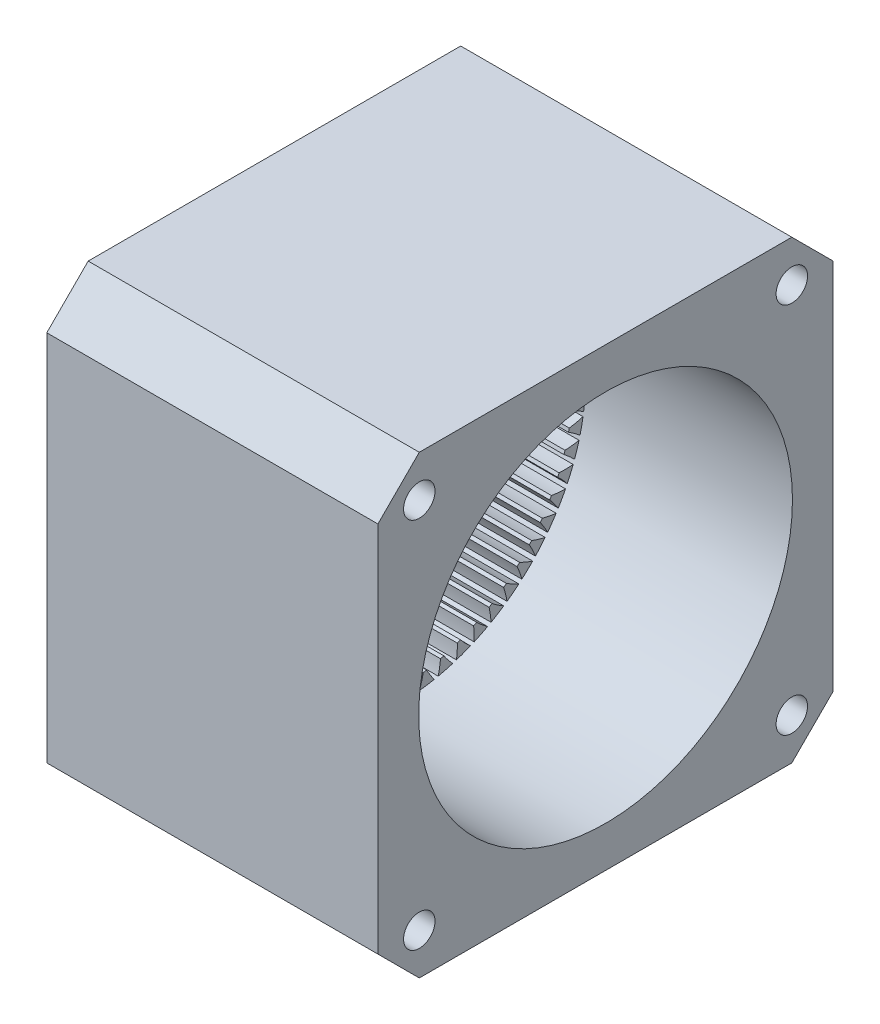
from build123d import *

# Parameters (mm, degrees)
BOSS_EXTRUDE1_START     = -15
BOSS_EXTRUDE1_OUTLINE_W = 55
BOSS_EXTRUDE1_OUTLINE_H = 55
BOSS_EXTRUDE1_DEPTH     = 15
SKETCH2_W               = 55
SKETCH2_H               = 55
SKETCH2_R               = 22.576
BOSS_EXTRUDE2_DEPTH     = 25
SKETCH3_R               = 1.9
CUT_EXTRUDE1_DEPTH      = 9
CHAMFER1_SIZE           = 5
CUT_EXTRUDE2_START      = -11
SKETCH4_R               = 1.9
CUT_EXTRUDE2_DEPTH      = 11


with BuildPart() as part:
    # Boss-Extrude1: read off the stored shape, not the designer's step
    # Boss-Extrude1 outline → Boss-Extrude1 (new body)
    with BuildSketch(Plane(origin=(15, 0, 0), x_dir=(0, 0, -1), z_dir=(1, 0, 0)).offset(BOSS_EXTRUDE1_START)):
        Rectangle(BOSS_EXTRUDE1_OUTLINE_W, BOSS_EXTRUDE1_OUTLINE_H)
        with BuildLine():
            ThreePointArc((0.241574021, 22.574707484), (0.579462287, 21.790723395), (0.854667122, 20.982600985))
            ThreePointArc((0.854667122, 20.982600985), (1.063632546, 20.973046651), (1.272492432, 20.961411284))
            ThreePointArc((1.272492432, 20.961411284), (1.628041668, 21.737545468), (2.043510693, 22.483323599))
            ThreePointArc((2.043510693, 22.483323599), (2.283976037, 22.460169845), (2.524179858, 22.434444322))
            ThreePointArc((2.524179858, 22.434444322), (2.781020174, 21.620299014), (2.973056634, 20.788480807))
            ThreePointArc((2.973056634, 20.788480807), (3.179983328, 20.757834811), (3.386594491, 20.725129137))
            ThreePointArc((3.386594491, 20.725129137), (3.818839711, 21.461310909), (4.307626222, 22.161230389))
            ThreePointArc((4.307626222, 22.161230389), (4.54451539, 22.113867954), (4.780884194, 22.063973403))
            ThreePointArc((4.780884194, 22.063973403), (4.954041031, 21.228021107), (5.060938561, 20.381042684))
            ThreePointArc((5.060938561, 20.381042684), (5.263703177, 20.329619496), (5.465945507, 20.27617912))
            ThreePointArc((5.465945507, 20.27617912), (5.970451292, 20.964854257), (6.527539676, 21.611732966))
            ThreePointArc((6.527539676, 21.611732966), (6.758421864, 21.540647852), (6.988530189, 21.467096259))
            ThreePointArc((6.988530189, 21.467096259), (7.076226723, 20.617914977), (7.096888411, 19.764467483))
            ThreePointArc((7.096888411, 19.764467483), (7.29341031, 19.692794775), (7.489208526, 19.619168067))
            ThreePointArc((7.489208526, 19.619168067), (8.060797963, 20.253269831), (8.680471741, 20.840469917))
            ThreePointArc((8.680471741, 20.840469917), (8.902977785, 20.746391555), (9.124464407, 20.649937658))
            ThreePointArc((9.124464407, 20.649937658), (9.125800753, 19.79624114), (9.060014582, 18.9450821))
            ThreePointArc((9.060014582, 18.9450821), (9.248277183, 18.853895331), (9.435622132, 18.760837801))
            ThreePointArc((9.435622132, 18.760837801), (10.068429939, 19.333859449), (10.744330418, 19.855355445))
            ThreePointArc((10.744330418, 19.855355445), (10.956177106, 19.739249206), (11.166769273, 19.620882753))
            ThreePointArc((11.166769273, 19.620882753), (11.081731719, 18.771431079), (10.930172743, 17.931294538))
            ThreePointArc((10.930172743, 17.931294538), (11.108244217, 17.821529407), (11.285213485, 17.709995951))
            ThreePointArc((11.285213485, 17.709995951), (11.972746199, 18.216057507), (12.697937726, 18.666498158))
            ThreePointArc((12.697937726, 18.666498158), (12.896951224, 18.529555449), (13.094487975, 18.390491039))
            ThreePointArc((13.094487975, 18.390491039), (12.923949121, 17.554000734), (12.688172541, 16.733507629))
            ThreePointArc((12.688172541, 16.733507629), (12.854225634, 16.606290476), (13.019003277, 16.477425578))
            ThreePointArc((13.019003277, 16.477425578), (13.754205882, 16.911334164), (14.52124701, 17.286097341))
            ThreePointArc((14.52124701, 17.286097341), (14.70538517, 17.129723378), (14.887839511, 16.971388001))
            ThreePointArc((14.887839511, 16.971388001), (14.633549316, 16.156442587), (14.315974518, 15.364012288))
            ThreePointArc((14.315974518, 15.364012288), (14.468305301, 15.220648532), (14.619200478, 15.07577452))
            ThreePointArc((14.619200478, 15.07577452), (15.3945288, 15.433077648), (16.19554865, 15.728317772))
            ThreePointArc((16.19554865, 15.728317772), (16.362921964, 15.554117165), (16.528421667, 15.378135557))
            ThreePointArc((16.528421667, 15.378135557), (16.192989492, 14.593097477), (15.796875225, 13.83686139))
            ThreePointArc((15.796875225, 13.83686139), (15.933920577, 13.678822137), (16.069384899, 13.519425615))
            ThreePointArc((16.069384899, 13.519425615), (16.876883019, 13.796456872), (17.703662044, 14.009144379))
            ThreePointArc((17.703662044, 14.009144379), (17.852553037, 13.818904662), (17.99939985, 13.627082631))
            ThreePointArc((17.99939985, 13.627082631), (17.586267684, 12.880007438), (17.115678615, 12.16772557))
            ThreePointArc((17.115678615, 12.16772557), (17.236032265, 11.996632517), (17.354675685, 11.824349109))
            ThreePointArc((17.354675685, 11.824349109), (18.186057581, 12.018265778), (19.030111908, 12.146218208))
            ThreePointArc((19.030111908, 12.146218208), (19.158992757, 11.941891497), (19.285679834, 11.736197397))
            ThreePointArc((19.285679834, 11.736197397), (18.799086972, 11.034751093), (18.258851982, 10.37373242))
            ThreePointArc((18.258851982, 10.37373242), (18.361278939, 10.191341213), (18.461884015, 10.00793878))
            ThreePointArc((18.461884015, 10.00793878), (19.308618583, 10.116751013), (20.161287073, 10.158655401))
            ThreePointArc((20.161287073, 10.158655401), (20.268835285, 9.942338365), (20.374062645, 9.724882897))
            ThreePointArc((20.374062645, 9.724882897), (19.819002188, 9.076263271), (19.214664819, 8.473290737))
            ThreePointArc((19.214664819, 8.473290737), (19.298114044, 8.281472957), (19.379648431, 8.088833456))
            ThreePointArc((19.379648431, 8.088833456), (20.233047029, 8.111424694), (21.08558015, 8.066851044))
            ThreePointArc((21.08558015, 8.066851044), (21.170692135, 7.840763388), (21.253380002, 7.613777938))
            ThreePointArc((21.253380002, 7.613777938), (20.635547621, 7.024640704), (19.973309193, 6.485901625))
            ThreePointArc((19.973309193, 6.485901625), (20.036924384, 6.286625582), (20.09855143, 6.086725755))
            ThreePointArc((20.09855143, 6.086725755), (20.949857033, 6.02286418), (21.79350664, 5.892269878))
            ThreePointArc((21.79350664, 5.892269878), (21.855309036, 5.658731569), (21.91460892, 5.424545314))
            ThreePointArc((21.91460892, 5.424545314), (21.240344412, 4.900935818), (20.527000386, 4.431958386))
            ThreePointArc((20.527000386, 4.431958386), (20.570128766, 4.227268922), (20.611216093, 4.022160011))
            ThreePointArc((20.611216093, 4.022160011), (21.451693155, 3.87250093), (22.277802262, 3.657226049))
            ThreePointArc((22.277802262, 3.657226049), (22.31566089, 3.418633505), (22.350964296, 3.179649515))
            ThreePointArc((22.350964296, 3.179649515), (21.627186527, 2.726940698), (20.870056779, 2.332537256))
            ThreePointArc((20.870056779, 2.332537256), (20.892255791, 2.124534762), (20.912381788, 1.916321462))
            ThreePointArc((20.912381788, 1.916321462), (21.733405876, 1.68240058), (22.533497486, 1.384654133))
            ThreePointArc((22.533497486, 1.384654133), (22.547023866, 1.143455636), (22.557968532, 0.902126209))
            ThreePointArc((22.557968532, 0.902126209), (21.792104442, 0.524963477), (20.998958147, 0.209181138))
            ThreePointArc((20.998958147, 0.209181138), (21, 0), (20.998958147, -0.209181138))
            ThreePointArc((20.998958147, -0.209181138), (21.792104442, -0.524963477), (22.557968532, -0.902126209))
            ThreePointArc((22.557968532, -0.902126209), (22.547023866, -1.143455636), (22.533497486, -1.384654133))
            ThreePointArc((22.533497486, -1.384654133), (21.733405876, -1.68240058), (20.912381788, -1.916321462))
            ThreePointArc((20.912381788, -1.916321462), (20.892255791, -2.124534762), (20.870056779, -2.332537256))
            ThreePointArc((20.870056779, -2.332537256), (21.627186527, -2.726940698), (22.350964296, -3.179649515))
            ThreePointArc((22.350964296, -3.179649515), (22.31566089, -3.418633505), (22.277802262, -3.657226049))
            ThreePointArc((22.277802262, -3.657226049), (21.451693155, -3.87250093), (20.611216093, -4.022160011))
            ThreePointArc((20.611216093, -4.022160011), (20.570128766, -4.227268922), (20.527000386, -4.431958386))
            ThreePointArc((20.527000386, -4.431958386), (21.240344412, -4.900935818), (21.91460892, -5.424545314))
            ThreePointArc((21.91460892, -5.424545314), (21.855309036, -5.658731569), (21.79350664, -5.892269878))
            ThreePointArc((21.79350664, -5.892269878), (20.949857033, -6.02286418), (20.09855143, -6.086725755))
            ThreePointArc((20.09855143, -6.086725755), (20.036924384, -6.286625582), (19.973309193, -6.485901625))
            ThreePointArc((19.973309193, -6.485901625), (20.635547621, -7.024640704), (21.253380002, -7.613777938))
            ThreePointArc((21.253380002, -7.613777938), (21.170692135, -7.840763388), (21.08558015, -8.066851044))
            ThreePointArc((21.08558015, -8.066851044), (20.233047029, -8.111424694), (19.379648431, -8.088833456))
            ThreePointArc((19.379648431, -8.088833456), (19.298114044, -8.281472957), (19.214664819, -8.473290737))
            ThreePointArc((19.214664819, -8.473290737), (19.819002188, -9.076263271), (20.374062645, -9.724882897))
            ThreePointArc((20.374062645, -9.724882897), (20.268835285, -9.942338365), (20.161287073, -10.158655401))
            ThreePointArc((20.161287073, -10.158655401), (19.308618583, -10.116751013), (18.461884015, -10.00793878))
            ThreePointArc((18.461884015, -10.00793878), (18.361278939, -10.191341213), (18.258851982, -10.37373242))
            ThreePointArc((18.258851982, -10.37373242), (18.799086972, -11.034751093), (19.285679834, -11.736197397))
            ThreePointArc((19.285679834, -11.736197397), (19.158992757, -11.941891497), (19.030111908, -12.146218208))
            ThreePointArc((19.030111908, -12.146218208), (18.186057581, -12.018265778), (17.354675685, -11.824349109))
            ThreePointArc((17.354675685, -11.824349109), (17.236032265, -11.996632517), (17.115678615, -12.16772557))
            ThreePointArc((17.115678615, -12.16772557), (17.586267684, -12.880007438), (17.99939985, -13.627082631))
            ThreePointArc((17.99939985, -13.627082631), (17.852553037, -13.818904662), (17.703662044, -14.009144379))
            ThreePointArc((17.703662044, -14.009144379), (16.876883019, -13.796456872), (16.069384899, -13.519425615))
            ThreePointArc((16.069384899, -13.519425615), (15.933920577, -13.678822137), (15.796875225, -13.83686139))
            ThreePointArc((15.796875225, -13.83686139), (16.192989492, -14.593097477), (16.528421667, -15.378135557))
            ThreePointArc((16.528421667, -15.378135557), (16.362921964, -15.554117165), (16.19554865, -15.728317772))
            ThreePointArc((16.19554865, -15.728317772), (15.3945288, -15.433077648), (14.619200478, -15.07577452))
            ThreePointArc((14.619200478, -15.07577452), (14.468305301, -15.220648532), (14.315974518, -15.364012288))
            ThreePointArc((14.315974518, -15.364012288), (14.633549316, -16.156442587), (14.887839511, -16.971388001))
            ThreePointArc((14.887839511, -16.971388001), (14.70538517, -17.129723378), (14.52124701, -17.286097341))
            ThreePointArc((14.52124701, -17.286097341), (13.754205882, -16.911334164), (13.019003277, -16.477425578))
            ThreePointArc((13.019003277, -16.477425578), (12.854225634, -16.606290476), (12.688172541, -16.733507629))
            ThreePointArc((12.688172541, -16.733507629), (12.923949121, -17.554000734), (13.094487975, -18.390491039))
            ThreePointArc((13.094487975, -18.390491039), (12.896951224, -18.529555449), (12.697937726, -18.666498158))
            ThreePointArc((12.697937726, -18.666498158), (11.972746199, -18.216057507), (11.285213485, -17.709995951))
            ThreePointArc((11.285213485, -17.709995951), (11.108244217, -17.821529407), (10.930172743, -17.931294538))
            ThreePointArc((10.930172743, -17.931294538), (11.081731719, -18.771431079), (11.166769273, -19.620882753))
            ThreePointArc((11.166769273, -19.620882753), (10.956177106, -19.739249206), (10.744330418, -19.855355445))
            ThreePointArc((10.744330418, -19.855355445), (10.068429939, -19.333859449), (9.435622132, -18.760837801))
            ThreePointArc((9.435622132, -18.760837801), (9.248277183, -18.853895331), (9.060014582, -18.9450821))
            ThreePointArc((9.060014582, -18.9450821), (9.125800753, -19.79624114), (9.124464407, -20.649937658))
            ThreePointArc((9.124464407, -20.649937658), (8.902977785, -20.746391555), (8.680471741, -20.840469917))
            ThreePointArc((8.680471741, -20.840469917), (8.060797963, -20.253269831), (7.489208526, -19.619168067))
            ThreePointArc((7.489208526, -19.619168067), (7.29341031, -19.692794775), (7.096888411, -19.764467483))
            ThreePointArc((7.096888411, -19.764467483), (7.076226723, -20.617914977), (6.988530189, -21.467096259))
            ThreePointArc((6.988530189, -21.467096259), (6.758421864, -21.540647852), (6.527539676, -21.611732966))
            ThreePointArc((6.527539676, -21.611732966), (5.970451292, -20.964854257), (5.465945507, -20.27617912))
            ThreePointArc((5.465945507, -20.27617912), (5.263703177, -20.329619496), (5.060938561, -20.381042684))
            ThreePointArc((5.060938561, -20.381042684), (4.954041031, -21.228021107), (4.780884194, -22.063973403))
            ThreePointArc((4.780884194, -22.063973403), (4.54451539, -22.113867954), (4.307626222, -22.161230389))
            ThreePointArc((4.307626222, -22.161230389), (3.818839711, -21.461310909), (3.386594491, -20.725129137))
            ThreePointArc((3.386594491, -20.725129137), (3.179983328, -20.757834811), (2.973056634, -20.788480807))
            ThreePointArc((2.973056634, -20.788480807), (2.781020174, -21.620299014), (2.524179858, -22.434444322))
            ThreePointArc((2.524179858, -22.434444322), (2.283976037, -22.460169845), (2.043510693, -22.483323599))
            ThreePointArc((2.043510693, -22.483323599), (1.628041668, -21.737545468), (1.272492432, -20.961411284))
            ThreePointArc((1.272492432, -20.961411284), (1.063632546, -20.973046651), (0.854667122, -20.982600985))
            ThreePointArc((0.854667122, -20.982600985), (0.579462287, -21.790723395), (0.241574021, -22.574707484))
            ThreePointArc((0.241574021, -22.574707484), (0, -22.576), (-0.241574021, -22.574707484))
            ThreePointArc((-0.241574021, -22.574707484), (-0.579462287, -21.790723395), (-0.854667122, -20.982600985))
            ThreePointArc((-0.854667122, -20.982600985), (-1.063632546, -20.973046651), (-1.272492432, -20.961411284))
            ThreePointArc((-1.272492432, -20.961411284), (-1.628041668, -21.737545468), (-2.043510693, -22.483323599))
            ThreePointArc((-2.043510693, -22.483323599), (-2.283976037, -22.460169845), (-2.524179858, -22.434444322))
            ThreePointArc((-2.524179858, -22.434444322), (-2.781020174, -21.620299014), (-2.973056634, -20.788480807))
            ThreePointArc((-2.973056634, -20.788480807), (-3.179983328, -20.757834811), (-3.386594491, -20.725129137))
            ThreePointArc((-3.386594491, -20.725129137), (-3.818839711, -21.461310909), (-4.307626222, -22.161230389))
            ThreePointArc((-4.307626222, -22.161230389), (-4.54451539, -22.113867954), (-4.780884194, -22.063973403))
            ThreePointArc((-4.780884194, -22.063973403), (-4.954041031, -21.228021107), (-5.060938561, -20.381042684))
            ThreePointArc((-5.060938561, -20.381042684), (-5.263703177, -20.329619496), (-5.465945507, -20.27617912))
            ThreePointArc((-5.465945507, -20.27617912), (-5.970451292, -20.964854257), (-6.527539676, -21.611732966))
            ThreePointArc((-6.527539676, -21.611732966), (-6.758421864, -21.540647852), (-6.988530189, -21.467096259))
            ThreePointArc((-6.988530189, -21.467096259), (-7.076226723, -20.617914977), (-7.096888411, -19.764467483))
            ThreePointArc((-7.096888411, -19.764467483), (-7.29341031, -19.692794775), (-7.489208526, -19.619168067))
            ThreePointArc((-7.489208526, -19.619168067), (-8.060797963, -20.253269831), (-8.680471741, -20.840469917))
            ThreePointArc((-8.680471741, -20.840469917), (-8.902977785, -20.746391555), (-9.124464407, -20.649937658))
            ThreePointArc((-9.124464407, -20.649937658), (-9.125800753, -19.79624114), (-9.060014582, -18.9450821))
            ThreePointArc((-9.060014582, -18.9450821), (-9.248277183, -18.853895331), (-9.435622132, -18.760837801))
            ThreePointArc((-9.435622132, -18.760837801), (-10.068429939, -19.333859449), (-10.744330418, -19.855355445))
            ThreePointArc((-10.744330418, -19.855355445), (-10.956177106, -19.739249206), (-11.166769273, -19.620882753))
            ThreePointArc((-11.166769273, -19.620882753), (-11.081731719, -18.771431079), (-10.930172743, -17.931294538))
            ThreePointArc((-10.930172743, -17.931294538), (-11.108244217, -17.821529407), (-11.285213485, -17.709995951))
            ThreePointArc((-11.285213485, -17.709995951), (-11.972746199, -18.216057507), (-12.697937726, -18.666498158))
            ThreePointArc((-12.697937726, -18.666498158), (-12.896951224, -18.529555449), (-13.094487975, -18.390491039))
            ThreePointArc((-13.094487975, -18.390491039), (-12.923949121, -17.554000734), (-12.688172541, -16.733507629))
            ThreePointArc((-12.688172541, -16.733507629), (-12.854225634, -16.606290476), (-13.019003277, -16.477425578))
            ThreePointArc((-13.019003277, -16.477425578), (-13.754205882, -16.911334164), (-14.52124701, -17.286097341))
            ThreePointArc((-14.52124701, -17.286097341), (-14.70538517, -17.129723378), (-14.887839511, -16.971388001))
            ThreePointArc((-14.887839511, -16.971388001), (-14.633549316, -16.156442587), (-14.315974518, -15.364012288))
            ThreePointArc((-14.315974518, -15.364012288), (-14.468305301, -15.220648532), (-14.619200478, -15.07577452))
            ThreePointArc((-14.619200478, -15.07577452), (-15.3945288, -15.433077648), (-16.19554865, -15.728317772))
            ThreePointArc((-16.19554865, -15.728317772), (-16.362921964, -15.554117165), (-16.528421667, -15.378135557))
            ThreePointArc((-16.528421667, -15.378135557), (-16.192989492, -14.593097477), (-15.796875225, -13.83686139))
            ThreePointArc((-15.796875225, -13.83686139), (-15.933920577, -13.678822137), (-16.069384899, -13.519425615))
            ThreePointArc((-16.069384899, -13.519425615), (-16.876883019, -13.796456872), (-17.703662044, -14.009144379))
            ThreePointArc((-17.703662044, -14.009144379), (-17.852553037, -13.818904662), (-17.99939985, -13.627082631))
            ThreePointArc((-17.99939985, -13.627082631), (-17.586267684, -12.880007438), (-17.115678615, -12.16772557))
            ThreePointArc((-17.115678615, -12.16772557), (-17.236032265, -11.996632517), (-17.354675685, -11.824349109))
            ThreePointArc((-17.354675685, -11.824349109), (-18.186057581, -12.018265778), (-19.030111908, -12.146218208))
            ThreePointArc((-19.030111908, -12.146218208), (-19.158992757, -11.941891497), (-19.285679834, -11.736197397))
            ThreePointArc((-19.285679834, -11.736197397), (-18.799086972, -11.034751093), (-18.258851982, -10.37373242))
            ThreePointArc((-18.258851982, -10.37373242), (-18.361278939, -10.191341213), (-18.461884015, -10.00793878))
            ThreePointArc((-18.461884015, -10.00793878), (-19.308618583, -10.116751013), (-20.161287073, -10.158655401))
            ThreePointArc((-20.161287073, -10.158655401), (-20.268835285, -9.942338365), (-20.374062645, -9.724882897))
            ThreePointArc((-20.374062645, -9.724882897), (-19.819002188, -9.076263271), (-19.214664819, -8.473290737))
            ThreePointArc((-19.214664819, -8.473290737), (-19.298114044, -8.281472957), (-19.379648431, -8.088833456))
            ThreePointArc((-19.379648431, -8.088833456), (-20.233047029, -8.111424694), (-21.08558015, -8.066851044))
            ThreePointArc((-21.08558015, -8.066851044), (-21.170692135, -7.840763388), (-21.253380002, -7.613777938))
            ThreePointArc((-21.253380002, -7.613777938), (-20.635547621, -7.024640704), (-19.973309193, -6.485901625))
            ThreePointArc((-19.973309193, -6.485901625), (-20.036924384, -6.286625582), (-20.09855143, -6.086725755))
            ThreePointArc((-20.09855143, -6.086725755), (-20.949857033, -6.02286418), (-21.79350664, -5.892269878))
            ThreePointArc((-21.79350664, -5.892269878), (-21.855309036, -5.658731569), (-21.91460892, -5.424545314))
            ThreePointArc((-21.91460892, -5.424545314), (-21.240344412, -4.900935818), (-20.527000386, -4.431958386))
            ThreePointArc((-20.527000386, -4.431958386), (-20.570128766, -4.227268922), (-20.611216093, -4.022160011))
            ThreePointArc((-20.611216093, -4.022160011), (-21.451693155, -3.87250093), (-22.277802262, -3.657226049))
            ThreePointArc((-22.277802262, -3.657226049), (-22.31566089, -3.418633505), (-22.350964296, -3.179649515))
            ThreePointArc((-22.350964296, -3.179649515), (-21.627186527, -2.726940698), (-20.870056779, -2.332537256))
            ThreePointArc((-20.870056779, -2.332537256), (-20.892255791, -2.124534762), (-20.912381788, -1.916321462))
            ThreePointArc((-20.912381788, -1.916321462), (-21.733405876, -1.68240058), (-22.533497486, -1.384654133))
            ThreePointArc((-22.533497486, -1.384654133), (-22.547023866, -1.143455636), (-22.557968532, -0.902126209))
            ThreePointArc((-22.557968532, -0.902126209), (-21.792104442, -0.524963477), (-20.998958147, -0.209181138))
            ThreePointArc((-20.998958147, -0.209181138), (-21, 0), (-20.998958147, 0.209181138))
            ThreePointArc((-20.998958147, 0.209181138), (-21.792104442, 0.524963477), (-22.557968532, 0.902126209))
            ThreePointArc((-22.557968532, 0.902126209), (-22.547023866, 1.143455636), (-22.533497486, 1.384654133))
            ThreePointArc((-22.533497486, 1.384654133), (-21.733405876, 1.68240058), (-20.912381788, 1.916321462))
            ThreePointArc((-20.912381788, 1.916321462), (-20.892255791, 2.124534762), (-20.870056779, 2.332537256))
            ThreePointArc((-20.870056779, 2.332537256), (-21.627186527, 2.726940698), (-22.350964296, 3.179649515))
            ThreePointArc((-22.350964296, 3.179649515), (-22.31566089, 3.418633505), (-22.277802262, 3.657226049))
            ThreePointArc((-22.277802262, 3.657226049), (-21.451693155, 3.87250093), (-20.611216093, 4.022160011))
            ThreePointArc((-20.611216093, 4.022160011), (-20.570128766, 4.227268922), (-20.527000386, 4.431958386))
            ThreePointArc((-20.527000386, 4.431958386), (-21.240344412, 4.900935818), (-21.91460892, 5.424545314))
            ThreePointArc((-21.91460892, 5.424545314), (-21.855309036, 5.658731569), (-21.79350664, 5.892269878))
            ThreePointArc((-21.79350664, 5.892269878), (-20.949857033, 6.02286418), (-20.09855143, 6.086725755))
            ThreePointArc((-20.09855143, 6.086725755), (-20.036924384, 6.286625582), (-19.973309193, 6.485901625))
            ThreePointArc((-19.973309193, 6.485901625), (-20.635547621, 7.024640704), (-21.253380002, 7.613777938))
            ThreePointArc((-21.253380002, 7.613777938), (-21.170692135, 7.840763388), (-21.08558015, 8.066851044))
            ThreePointArc((-21.08558015, 8.066851044), (-20.233047029, 8.111424694), (-19.379648431, 8.088833456))
            ThreePointArc((-19.379648431, 8.088833456), (-19.298114044, 8.281472957), (-19.214664819, 8.473290737))
            ThreePointArc((-19.214664819, 8.473290737), (-19.819002188, 9.076263271), (-20.374062645, 9.724882897))
            ThreePointArc((-20.374062645, 9.724882897), (-20.268835285, 9.942338365), (-20.161287073, 10.158655401))
            ThreePointArc((-20.161287073, 10.158655401), (-19.308618583, 10.116751013), (-18.461884015, 10.00793878))
            ThreePointArc((-18.461884015, 10.00793878), (-18.361278939, 10.191341213), (-18.258851982, 10.37373242))
            ThreePointArc((-18.258851982, 10.37373242), (-18.799086972, 11.034751093), (-19.285679834, 11.736197397))
            ThreePointArc((-19.285679834, 11.736197397), (-19.158992757, 11.941891497), (-19.030111908, 12.146218208))
            ThreePointArc((-19.030111908, 12.146218208), (-18.186057581, 12.018265778), (-17.354675685, 11.824349109))
            ThreePointArc((-17.354675685, 11.824349109), (-17.236032265, 11.996632517), (-17.115678615, 12.16772557))
            ThreePointArc((-17.115678615, 12.16772557), (-17.586267684, 12.880007438), (-17.99939985, 13.627082631))
            ThreePointArc((-17.99939985, 13.627082631), (-17.852553037, 13.818904662), (-17.703662044, 14.009144379))
            ThreePointArc((-17.703662044, 14.009144379), (-16.876883019, 13.796456872), (-16.069384899, 13.519425615))
            ThreePointArc((-16.069384899, 13.519425615), (-15.933920577, 13.678822137), (-15.796875225, 13.83686139))
            ThreePointArc((-15.796875225, 13.83686139), (-16.192989492, 14.593097477), (-16.528421667, 15.378135557))
            ThreePointArc((-16.528421667, 15.378135557), (-16.362921964, 15.554117165), (-16.19554865, 15.728317772))
            ThreePointArc((-16.19554865, 15.728317772), (-15.3945288, 15.433077648), (-14.619200478, 15.07577452))
            ThreePointArc((-14.619200478, 15.07577452), (-14.468305301, 15.220648532), (-14.315974518, 15.364012288))
            ThreePointArc((-14.315974518, 15.364012288), (-14.633549316, 16.156442587), (-14.887839511, 16.971388001))
            ThreePointArc((-14.887839511, 16.971388001), (-14.70538517, 17.129723378), (-14.52124701, 17.286097341))
            ThreePointArc((-14.52124701, 17.286097341), (-13.754205882, 16.911334164), (-13.019003277, 16.477425578))
            ThreePointArc((-13.019003277, 16.477425578), (-12.854225634, 16.606290476), (-12.688172541, 16.733507629))
            ThreePointArc((-12.688172541, 16.733507629), (-12.923949121, 17.554000734), (-13.094487975, 18.390491039))
            ThreePointArc((-13.094487975, 18.390491039), (-12.896951224, 18.529555449), (-12.697937726, 18.666498158))
            ThreePointArc((-12.697937726, 18.666498158), (-11.972746199, 18.216057507), (-11.285213485, 17.709995951))
            ThreePointArc((-11.285213485, 17.709995951), (-11.108244217, 17.821529407), (-10.930172743, 17.931294538))
            ThreePointArc((-10.930172743, 17.931294538), (-11.081731719, 18.771431079), (-11.166769273, 19.620882753))
            ThreePointArc((-11.166769273, 19.620882753), (-10.956177106, 19.739249206), (-10.744330418, 19.855355445))
            ThreePointArc((-10.744330418, 19.855355445), (-10.068429939, 19.333859449), (-9.435622132, 18.760837801))
            ThreePointArc((-9.435622132, 18.760837801), (-9.248277183, 18.853895331), (-9.060014582, 18.9450821))
            ThreePointArc((-9.060014582, 18.9450821), (-9.125800753, 19.79624114), (-9.124464407, 20.649937658))
            ThreePointArc((-9.124464407, 20.649937658), (-8.902977785, 20.746391555), (-8.680471741, 20.840469917))
            ThreePointArc((-8.680471741, 20.840469917), (-8.060797963, 20.253269831), (-7.489208526, 19.619168067))
            ThreePointArc((-7.489208526, 19.619168067), (-7.29341031, 19.692794775), (-7.096888411, 19.764467483))
            ThreePointArc((-7.096888411, 19.764467483), (-7.076226723, 20.617914977), (-6.988530189, 21.467096259))
            ThreePointArc((-6.988530189, 21.467096259), (-6.758421864, 21.540647852), (-6.527539676, 21.611732966))
            ThreePointArc((-6.527539676, 21.611732966), (-5.970451292, 20.964854257), (-5.465945507, 20.27617912))
            ThreePointArc((-5.465945507, 20.27617912), (-5.263703177, 20.329619496), (-5.060938561, 20.381042684))
            ThreePointArc((-5.060938561, 20.381042684), (-4.954041031, 21.228021107), (-4.780884194, 22.063973403))
            ThreePointArc((-4.780884194, 22.063973403), (-4.54451539, 22.113867954), (-4.307626222, 22.161230389))
            ThreePointArc((-4.307626222, 22.161230389), (-3.818839711, 21.461310909), (-3.386594491, 20.725129137))
            ThreePointArc((-3.386594491, 20.725129137), (-3.179983328, 20.757834811), (-2.973056634, 20.788480807))
            ThreePointArc((-2.973056634, 20.788480807), (-2.781020174, 21.620299014), (-2.524179858, 22.434444322))
            ThreePointArc((-2.524179858, 22.434444322), (-2.283976037, 22.460169845), (-2.043510693, 22.483323599))
            ThreePointArc((-2.043510693, 22.483323599), (-1.628041668, 21.737545468), (-1.272492432, 20.961411284))
            ThreePointArc((-1.272492432, 20.961411284), (-1.063632546, 20.973046651), (-0.854667122, 20.982600985))
            ThreePointArc((-0.854667122, 20.982600985), (-0.579462287, 21.790723395), (-0.241574021, 22.574707484))
            ThreePointArc((-0.241574021, 22.574707484), (0, 22.576), (0.241574021, 22.574707484))
        make_face(mode=Mode.SUBTRACT)
    extrude(amount=BOSS_EXTRUDE1_DEPTH)

    # Sketch2 → Boss-Extrude2 (add)
    with BuildSketch(Plane(origin=(15, 0, 0), x_dir=(0, 0, -1), z_dir=(1, 0, 0))):
        Rectangle(SKETCH2_W, SKETCH2_H)
        with Locations(Location((0, 0, 0), (0, 0, 177.709878196))):
            Circle(SKETCH2_R, mode=Mode.SUBTRACT)
    extrude(amount=BOSS_EXTRUDE2_DEPTH)

    # Sketch3 → Cut-Extrude1 (cut)
    with BuildSketch(Plane.ZY):
        with Locations((22.5, 22.5)):
            Circle(SKETCH3_R)
        with Locations((22.5, -22.5)):
            Circle(SKETCH3_R)
        with Locations((-22.5, -22.5)):
            Circle(SKETCH3_R)
        with Locations((-22.5, 22.5)):
            Circle(SKETCH3_R)
    extrude(amount=-CUT_EXTRUDE1_DEPTH, mode=Mode.SUBTRACT)

    # Chamfer1
    chamfer1_edges = [part.edges().sort_by_distance(p)[0] for p in [
        (20, -27.5, 27.5),
        (20, 27.5, 27.5),
        (20, 27.5, -27.5),
        (20, -27.5, -27.5),
    ]]
    chamfer(chamfer1_edges, length=CHAMFER1_SIZE)

    # Sketch4 → Cut-Extrude2 (cut)
    with BuildSketch(Plane(origin=(40, 0, 0), x_dir=(0, 0, -1), z_dir=(1, 0, 0)).offset(CUT_EXTRUDE2_START)):
        with Locations(Location((22.5, 22.5, 0), (0, 0, 180))):
            Circle(SKETCH4_R)
        with Locations(Location((22.5, -22.5, 0), (0, 0, 180))):
            Circle(SKETCH4_R)
        with Locations(Location((-22.5, -22.5, 0), (0, 0, 180))):
            Circle(SKETCH4_R)
        with Locations(Location((-22.5, 22.5, 0), (0, 0, 180))):
            Circle(SKETCH4_R)
    extrude(amount=CUT_EXTRUDE2_DEPTH, mode=Mode.SUBTRACT)


solid = part.part
